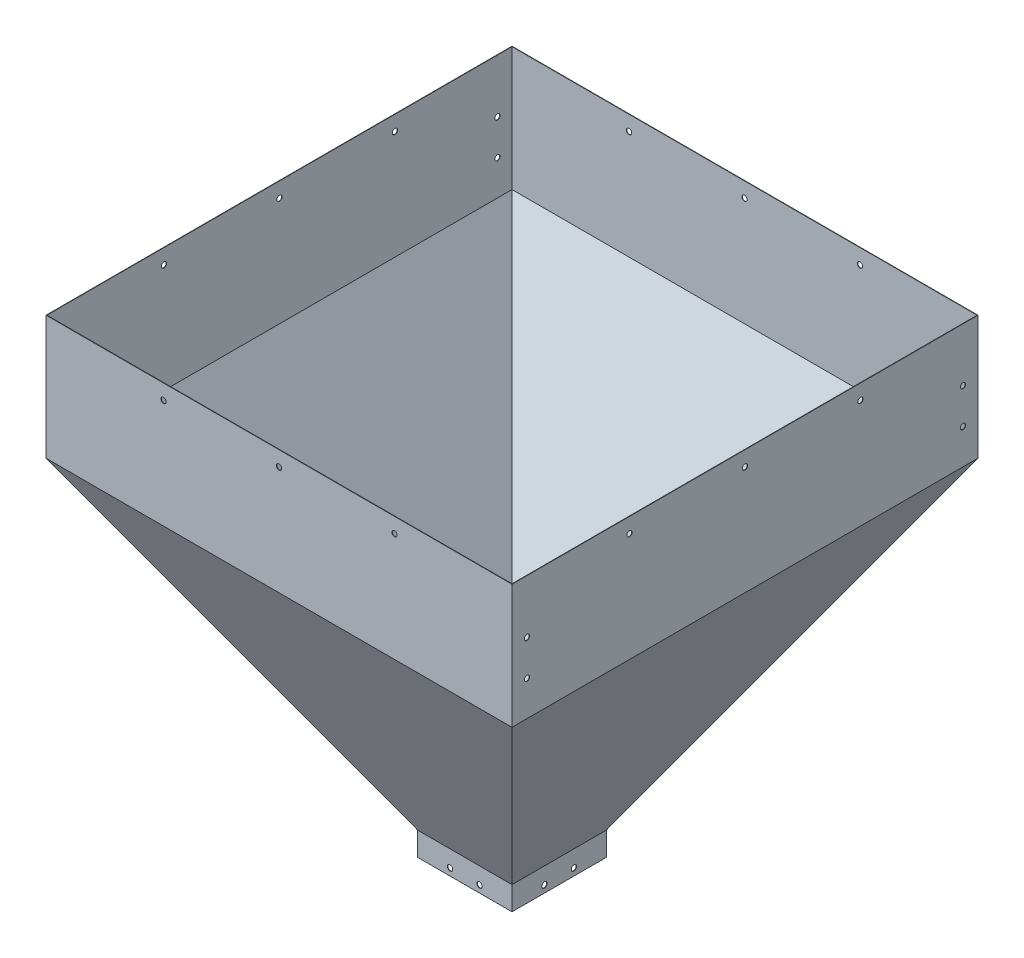
from build123d import *

# Parameters (mm, degrees)
CROQUIS3_W                       = 790
CROQUIS3_H                       = 790
SALIENTE_EXTRUIR1_DEPTH          = 210
VACIADO2_T                       = -0.76
CROQUIS5_W                       = 160
CROQUIS5_H                       = 160
CROQUIS5_W_2                     = 158.245179758
CROQUIS5_H_2                     = 158.245179758
SALIENTE_EXTRUIR2_DEPTH          = 40
TALADRO_DE_MARGEN_PARA_M81_D     = 9
TALADRO_DE_MARGEN_PARA_M81_DEPTH = 840.799
TALADRO_DE_MARGEN_PARA_M82_D     = 9
TALADRO_DE_MARGEN_PARA_M82_DEPTH = 840.799
TALADRO_DE_MARGEN_PARA_M85_D     = 9
TALADRO_DE_MARGEN_PARA_M86_D     = 9


with BuildPart() as part:
    # Croquis1 → Recubrir1 section 0
    with BuildSketch(Plane(origin=(0, 0, 0), x_dir=(1, 0, 0), z_dir=(0, 1, 0))):
        with BuildLine():
            Line((-395, 395), (395, 395))
            Line((395, 395), (395, -395))
            Line((395, -395), (-395, -395))
            Line((-395, -395), (-395, 395))
        make_face()
    # Croquis2 → Recubrir1 section 1
    with BuildSketch(Plane(origin=(0, -546, 0), x_dir=(1, 0, 0), z_dir=(0, 1, 0))):
        with BuildLine():
            Line((-80, 80), (80, 80))
            Line((80, 80), (80, -80))
            Line((80, -80), (-80, -80))
            Line((-80, -80), (-80, 80))
        make_face()
    loft()

    # Croquis3 → Saliente-Extruir1 (add)
    with BuildSketch(Plane(origin=(0, 0, 0), x_dir=(1, 0, 0), z_dir=(0, 1, 0))):
        Rectangle(CROQUIS3_W, CROQUIS3_H)
    extrude(amount=SALIENTE_EXTRUIR1_DEPTH)

    # Vaciado2
    vaciado2_openings = [part.faces().sort_by_distance(p)[0] for p in [
        (0, -546, 0),
        (0, 210, 0),
    ]]
    offset(amount=VACIADO2_T, openings=vaciado2_openings)

    # Croquis5 → Saliente-Extruir2 (add)
    with BuildSketch(Plane.XZ.offset(546)):
        Rectangle(CROQUIS5_W, CROQUIS5_H)
        Rectangle(CROQUIS5_W_2, CROQUIS5_H_2, mode=Mode.SUBTRACT)
    extrude(amount=SALIENTE_EXTRUIR2_DEPTH)

    # Taladro de margen para M81
    with Locations(Plane(origin=(99.241615772, -484.70137926, -395), x_dir=(-1, 0, 0), z_dir=(0, 0, -1))):
        with Locations((99.241615772, 669.29173997), (-96.558384228, 669.29173997), (295.041615772, 669.29173997)):
            Hole(TALADRO_DE_MARGEN_PARA_M81_D / 2, depth=TALADRO_DE_MARGEN_PARA_M81_DEPTH)

    # Taladro de margen para M82
    with Locations(Plane(origin=(-395, -484.70137926, -1480.0002), x_dir=(0, 0, 1), z_dir=(-1, 0, 0))):
        with Locations((1284.2002, 669.29173997), (1480.0002, 669.29173997), (1675.8002, 669.29173997), (1849.6002, 603.89173997), (1849.6002, 543.89173997), (1110.4002, 543.89173997), (1110.4002, 603.89173997)):
            Hole(TALADRO_DE_MARGEN_PARA_M82_D / 2, depth=TALADRO_DE_MARGEN_PARA_M82_DEPTH)

    # Taladro de margen para M85 (through all)
    with Locations(Plane(origin=(99.241615772, -484.70137926, 80), x_dir=(1, 0, 0), z_dir=(0, 0, 1))):
        with Locations((-124.241615772, -89.29862074), (-74.241615772, -89.29862074)):
            Hole(TALADRO_DE_MARGEN_PARA_M85_D / 2)

    # Taladro de margen para M86 (through all)
    with Locations(Plane(origin=(-80, -484.70137926, -1480.0002), x_dir=(0, 0, 1), z_dir=(-1, 0, 0))):
        with Locations((1505.0002, -89.29862074), (1455.0002, -89.29862074)):
            Hole(TALADRO_DE_MARGEN_PARA_M86_D / 2)


solid = part.part
